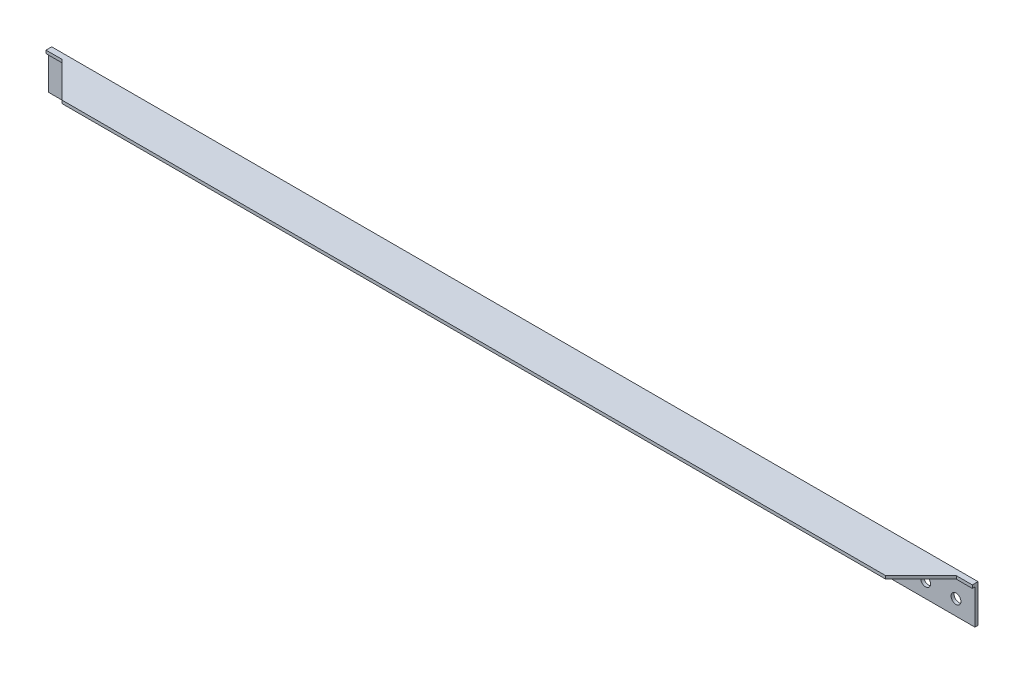
from build123d import *

# Parameters (mm, degrees)
SKETCH_1_W          = 2440
SKETCH_1_H          = 100
SKETCH_1_R          = 13
EXTRUDE_748_DEPTH   = 8
SKETCH_2_W          = 2440
SKETCH_2_H          = 8
EXTRUDE_1_DEPTH     = 100
CUT_EXTRUDE_1_DEPTH = 1229.846613699


with BuildPart() as part:
    # 草图1 → Extrude 748 (new body)
    with BuildSketch(Plane.XY):
        with Locations((0, 50)):
            Rectangle(SKETCH_1_W, SKETCH_1_H)
        with Locations((1090, 40)):
            Circle(SKETCH_1_R, mode=Mode.SUBTRACT)
        with Locations((1170, 40)):
            Circle(SKETCH_1_R, mode=Mode.SUBTRACT)
        with Locations((-1170, 40)):
            Circle(SKETCH_1_R, mode=Mode.SUBTRACT)
        with Locations((-1090, 40)):
            Circle(SKETCH_1_R, mode=Mode.SUBTRACT)
        with Locations((0, 40)):
            Circle(SKETCH_1_R, mode=Mode.SUBTRACT)
        with Locations((80, 40)):
            Circle(SKETCH_1_R, mode=Mode.SUBTRACT)
        with Locations((160, 40)):
            Circle(SKETCH_1_R, mode=Mode.SUBTRACT)
        with Locations((-160, 40)):
            Circle(SKETCH_1_R, mode=Mode.SUBTRACT)
        with Locations((-80, 40)):
            Circle(SKETCH_1_R, mode=Mode.SUBTRACT)
    extrude(amount=EXTRUDE_748_DEPTH)

    # 草图2 → 凸台-拉伸1 (add)
    with BuildSketch(Plane.XY.offset(8)):
        with Locations((0, 96)):
            Rectangle(SKETCH_2_W, SKETCH_2_H)
    extrude(amount=EXTRUDE_1_DEPTH)

    # 草图3 → 切除-拉伸1 (cut, through all)
    with BuildSketch(Plane(origin=(0, 100, 0), x_dir=(-1, 0, 0), z_dir=(0, 1, 0))):
        Polygon((-1085, 108), (-1178, 15), (-1220, 15), (-1220, 108), align=None)
        Polygon((1220, 15), (1178, 15), (1085, 108), (1220, 108), align=None)
    extrude(amount=-CUT_EXTRUDE_1_DEPTH, mode=Mode.SUBTRACT)


solid = part.part
